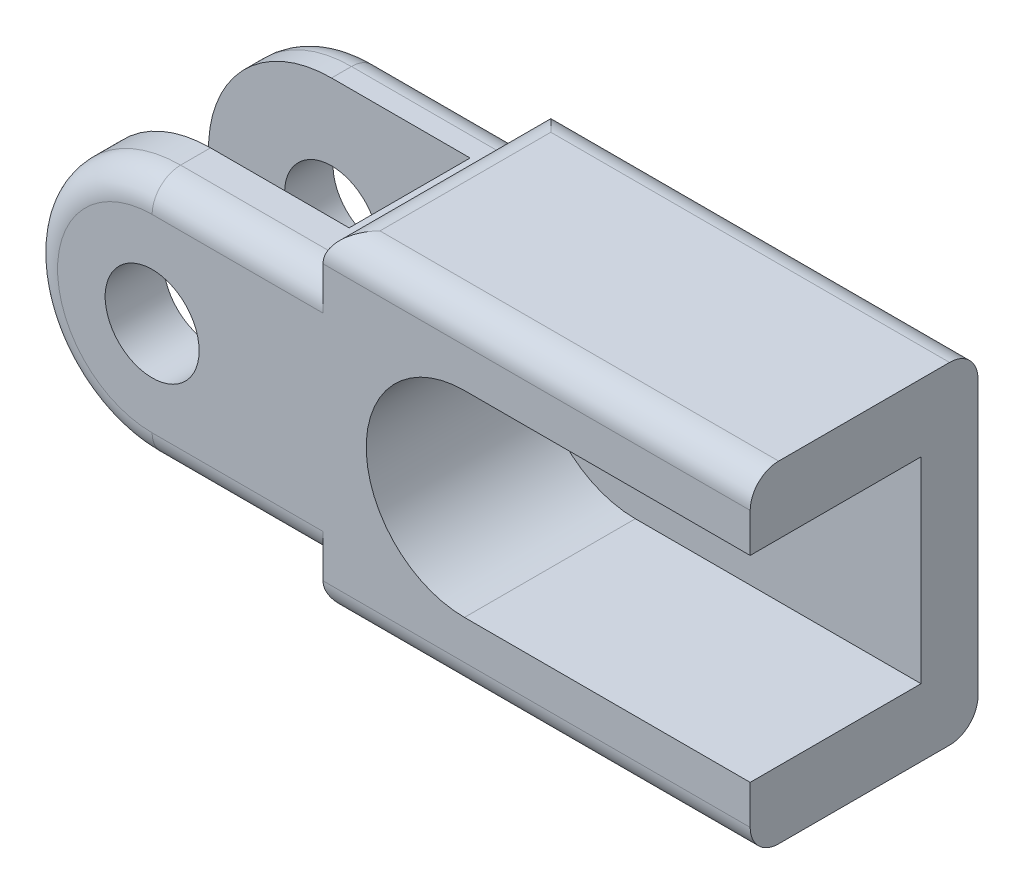
from build123d import *

# Parameters (mm, degrees)
BOSS_EXTRUDE1_OUTLINE_W = 40
BOSS_EXTRUDE1_OUTLINE_H = 12
BOSS_EXTRUDE1_DEPTH     = 10
CUT_EXTRUDE1_DEPTH      = 6
SKETCH3_R               = 1.35
CUT_EXTRUDE2_DEPTH      = 27
SKETCH4_W               = 40.172055773
SKETCH4_H               = 12
CUT_EXTRUDE3_DEPTH      = 2
CUT_EXTRUDE6_DEPTH      = 25
CUT_EXTRUDE9_DEPTH      = 20
SKETCH14_W              = 8
SKETCH14_H              = 1.679652208
CUT_EXTRUDE10_DEPTH     = 24.151673806
BOSS_EXTRUDE4_START     = -4
BOSS_EXTRUDE4_DEPTH     = 8
FILLET7_R               = 0.5
SKETCH18_W              = 15
SKETCH18_H              = 1.5
BOSS_EXTRUDE7_DEPTH     = 8
SKETCH23_W              = 8
SKETCH23_H              = 8.64
BOSS_EXTRUDE9_DEPTH     = 5
SKETCH24_R              = 1.65
CUT_EXTRUDE13_DEPTH     = 23.313145193
SKETCH25_W              = 15.080583778
SKETCH25_H              = 4.25
CUT_EXTRUDE14_DEPTH     = 25.552672093
FILLET13_R              = 1


# Read off the part's stored shape, not the designer's step: Boss-Extrude1, Boss-Extrude4
with BuildPart() as part:
    # Boss-Extrude1 outline → Boss-Extrude1 (new body)
    with BuildSketch(Plane.XY):
        Rectangle(BOSS_EXTRUDE1_OUTLINE_W, BOSS_EXTRUDE1_OUTLINE_H)
    extrude(amount=BOSS_EXTRUDE1_DEPTH)

    # Sketch2 → Cut-Extrude1 (cut)
    with BuildSketch(Plane.XY.offset(10)):
        with BuildLine():
            Line((20.002042678, 3.45), (20, -3.45))
            Line((20, -3.45), (9.967611838, -3.45))
            ThreePointArc((9.967611838, -3.45), (6.517611838, 0), (9.967611838, 3.45))
            Line((9.967611838, 3.45), (20.002042678, 3.45))
        make_face()
    extrude(amount=-CUT_EXTRUDE1_DEPTH, mode=Mode.SUBTRACT)

    # Sketch3 → Cut-Extrude2 (cut)
    with BuildSketch(Plane.XY.offset(4)):
        with Locations((13.967611838, 0)):
            Circle(SKETCH3_R)
        with Locations((9.967611838, 0)):
            Circle(SKETCH3_R)
    extrude(amount=-CUT_EXTRUDE2_DEPTH, mode=Mode.SUBTRACT)

    # Sketch4 → Cut-Extrude3 (cut)
    with BuildSketch(Plane(origin=(0, 0, 0), x_dir=(-1, 0, 0), z_dir=(0, 0, -1))):
        with Locations((0.086027887, 0)):
            Rectangle(SKETCH4_W, SKETCH4_H)
    extrude(amount=-CUT_EXTRUDE3_DEPTH, mode=Mode.SUBTRACT)

    # Sketch7 → Cut-Extrude6 (cut)
    with BuildSketch(Plane.ZY.offset(20)):
        Polygon((2, 6), (2, 2.309401077), (2, -2.309401077), (2, -6), (10, -6), (10, -2.309401077), (10, 2.309401077), (10, 6), align=None)
        Polygon((9.256150484, -1.879939359), (6, -3.759878717), (2.743849516, -1.879939359), (2.743849516, 1.879939359), (6, 3.759878717), (9.256150484, 1.879939359), align=None, mode=Mode.SUBTRACT)
    extrude(amount=-CUT_EXTRUDE6_DEPTH, mode=Mode.SUBTRACT)

    # Sketch11 → Cut-Extrude9 (cut)
    with BuildSketch(Plane.ZY.offset(20)):
        Polygon((10, -2.309401077), (10, 2.309401077), (6, 4.618802154), (2, 2.309401077), (2, -2.309401077), (6, -4.618802154), align=None)
    extrude(amount=-CUT_EXTRUDE9_DEPTH, mode=Mode.SUBTRACT)

    # Sketch14 → Cut-Extrude10 (cut, through all)
    with BuildSketch(Plane.ZY):
        with Locations((6, -5.160173896)):
            Rectangle(SKETCH14_W, SKETCH14_H)
    cut_extrude10 = extrude(amount=-CUT_EXTRUDE10_DEPTH, mode=Mode.SUBTRACT)

    # Mirror4: Cut-Extrude10 across plane
    add(cut_extrude10.mirror(Plane.ZX), mode=Mode.SUBTRACT)

    # Boss-Extrude4 outline → Boss-Extrude4 (add)
    with BuildSketch(Plane.XY.offset(6).offset(BOSS_EXTRUDE4_START)):
        with BuildLine():
            ThreePointArc((-1, 4.320347792), (-5.320347792, 0), (-1, -4.320347792))
            Line((-1, -4.320347792), (0, -4.320347792))
            Line((0, -4.320347792), (0, -4.203023322))
            ThreePointArc((0, -4.203023322), (3.320347792, 0), (0, 4.203023322))
            Line((0, 4.203023322), (0, 4.320347792))
            Line((0, 4.320347792), (-1, 4.320347792))
        make_face()
    extrude(amount=BOSS_EXTRUDE4_DEPTH)

    # Fillet7
    fillet7_edges = [part.edges().sort_by_distance(p)[0] for p in [
        (3.06403913, 3.759878717, 6),
        (3.944944283, 1.879939359, 2.743849516),
        (3.944944283, -1.879939359, 2.743849516),
        (3.06403913, -3.759878717, 6),
        (3.944944283, -1.879939359, 9.256150484),
        (3.944944283, 1.879939359, 9.256150484),
    ]]
    fillet(fillet7_edges, radius=FILLET7_R)

    # Sketch18 → Boss-Extrude7 (add)
    with BuildSketch(Plane.XY.offset(10)):
        with Locations((12.5, 5.070347792)):
            Rectangle(SKETCH18_W, SKETCH18_H)
        with Locations((12.5, -5.070347792)):
            Rectangle(SKETCH18_W, SKETCH18_H)
    extrude(amount=-BOSS_EXTRUDE7_DEPTH)

    # Sketch23 → Boss-Extrude9 (add)
    with BuildSketch(Plane(origin=(0, 0, 0), x_dir=(0, 0, -1), z_dir=(1, 0, 0))):
        with Locations((-6, 0.000347792)):
            Rectangle(SKETCH23_W, SKETCH23_H)
    extrude(amount=BOSS_EXTRUDE9_DEPTH)

    # Sketch24 → Cut-Extrude13 (cut, through all)
    with BuildSketch(Plane.XY.offset(10)):
        with Locations((-1, 0)):
            Circle(SKETCH24_R)
    extrude(amount=-CUT_EXTRUDE13_DEPTH, mode=Mode.SUBTRACT)

    # Sketch25 → Cut-Extrude14 (cut, through all)
    with BuildSketch(Plane(origin=(0, 4.320347792, 0), x_dir=(1, 0, 0), z_dir=(0, 1, 0))):
        with Locations((-3.674163861, -5.825)):
            Rectangle(SKETCH25_W, SKETCH25_H)
    extrude(amount=-CUT_EXTRUDE14_DEPTH, mode=Mode.SUBTRACT)

    # Fillet13
    fillet13_edges = [part.edges().sort_by_distance(p)[0] for p in [
        (-5.320347792, 0, 2),
        (2.5, 4.320347792, 10),
        (-0.5, -4.320347792, 2),
        (2.5, 4.320347792, 2),
        (-5.320347792, 0, 10),
        (-0.5, -4.320347792, 10),
        (12.5, 5.820347792, 2),
        (5, 5.820347792, 6),
        (12.5, 5.820347792, 10),
        (5, -5.820347792, 6),
        (12.5, -5.820347792, 2),
        (12.5, -5.820347792, 10),
        (0, -4.32, 2),
        (0, -4.32, 10),
        (2.5, -4.319652208, 10),
        (2.5, -4.319652208, 2),
    ]]
    fillet(fillet13_edges, radius=FILLET13_R)


solid = part.part
